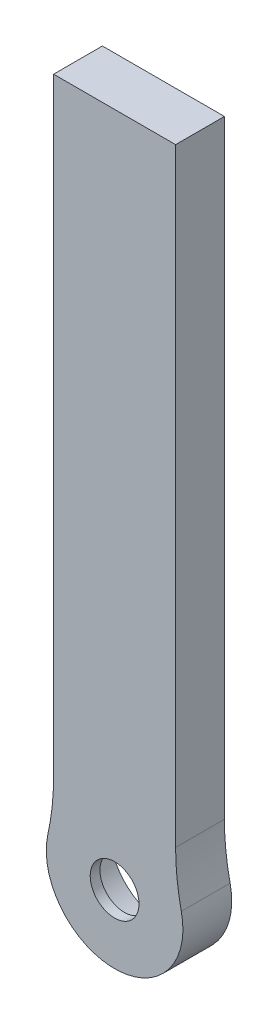
from build123d import *

# Parameters (mm, degrees)
SKETCH2_R           = 11
BOSS_EXTRUDE1_DEPTH = 10
BOSS_EXTRUDE3_START = 2
SKETCH6_R           = 11
SKETCH6_R_2         = 5
BOSS_EXTRUDE3_DEPTH = 2
SKETCH11_W          = 21
SKETCH11_H          = 110
CUT_EXTRUDE1_DEPTH  = 8
FILLET2_R           = 50
FILLET3_R           = 2


with BuildPart() as part:
    # Sketch2 → Boss-Extrude1 (new body)
    with BuildSketch(Plane.XY):
        with BuildLine():
            Line((12.5, 138.478281378), (-12.5, 138.478281378))
            Line((-12.5, 138.478281378), (-12.5, 6.304760106))
            ThreePointArc((-12.5, 6.304760106), (0, -14), (12.5, 6.304760106))
            Line((12.5, 6.304760106), (12.5, 138.478281378))
        make_face()
        Circle(SKETCH2_R, mode=Mode.SUBTRACT)
    extrude(amount=BOSS_EXTRUDE1_DEPTH)

    # Sketch6 → Boss-Extrude3 (add)
    with BuildSketch(Plane(origin=(0, 0, 10), x_dir=(-1, 0, 0), z_dir=(0, 0, -1)).offset(BOSS_EXTRUDE3_START)):
        Circle(SKETCH6_R)
        Circle(SKETCH6_R_2, mode=Mode.SUBTRACT)
    extrude(amount=-BOSS_EXTRUDE3_DEPTH)

    # Sketch11 → Cut-Extrude1 (cut)
    with BuildSketch(Plane(origin=(0, 0, 0), x_dir=(-1, 0, 0), z_dir=(0, 0, -1))):
        with Locations((0, 75)):
            Rectangle(SKETCH11_W, SKETCH11_H)
    extrude(amount=-CUT_EXTRUDE1_DEPTH, mode=Mode.SUBTRACT)

    # Fillet2
    fillet2_edges = [part.edges().sort_by_distance(p)[0] for p in [
        (12.5, 6.304760106, 5),
        (-12.5, 6.304760106, 5),
    ]]
    fillet(fillet2_edges, radius=FILLET2_R)

    # Fillet3
    fillet3_edges = [part.edges().sort_by_distance(p)[0] for p in [
        (10.5, 75, 0),
        (0, 20, 0),
        (-10.5, 75, 0),
        (0, 130, 0),
        (-10.5, 130, 4),
        (10.5, 130, 4),
    ]]
    fillet(fillet3_edges, radius=FILLET3_R - 0.0001)  # a hair under: the kernel refuses the full size


solid = part.part
